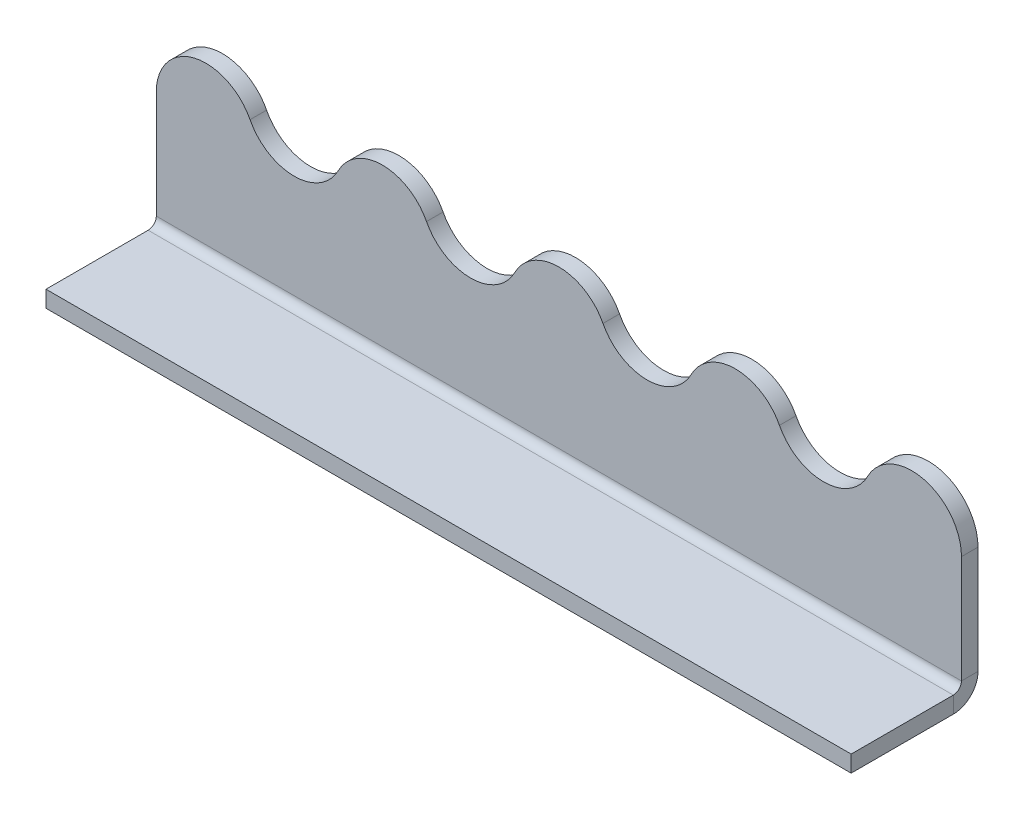
from build123d import *

# Parameters (mm, degrees)
SM_BASE_FLANGE_1_DEPTH           = 1.5
SM_EDGE_FLANGE_1_STRIP_W         = 7.48
SM_EDGE_FLANGE_1_STRIP_H         = 1.5
SM_EDGE_FLANGE_1_STRIP_CUT_DEPTH = 73
SM_EDGE_FLANGE_1_DEPTH           = 73


# Sheet-metal steps are written as plain solids
with BuildPart() as part:
    # Sketch 1 → Базовая кромка1 (new body)
    with BuildSketch(Plane.XY):
        with BuildLine():
            Line((-36.5, 0), (36.5, 0))
            Line((36.5, 0), (36.5, 10.5))
            ThreePointArc((36.5, 10.5), (33.060660172, 14.873213921), (28, 12.561552813))
            ThreePointArc((28, 12.561552813), (24, 10.123105626), (20, 12.561552813))
            ThreePointArc((20, 12.561552813), (16, 15), (12, 12.561552813))
            ThreePointArc((12, 12.561552813), (8, 10.123105626), (4, 12.561552813))
            ThreePointArc((4, 12.561552813), (0, 15), (-4, 12.561552813))
            ThreePointArc((-4, 12.561552813), (-8, 10.123105626), (-12, 12.561552813))
            ThreePointArc((-12, 12.561552813), (-16, 15), (-20, 12.561552813))
            ThreePointArc((-20, 12.561552813), (-24, 10.123105626), (-28, 12.561552813))
            ThreePointArc((-28, 12.561552813), (-33.060660172, 14.873213921), (-36.5, 10.5))
            Line((-36.5, 10.5), (-36.5, 0))
        make_face()
    extrude(amount=-SM_BASE_FLANGE_1_DEPTH)

    # Ребро-кромка1 strip (across the edge) → Ребро-кромка1 strip cut (cut)
    with BuildSketch(Plane.YZ.offset(-36.5)):
        with Locations((-3, -0.75)):
            Rectangle(SM_EDGE_FLANGE_1_STRIP_W, SM_EDGE_FLANGE_1_STRIP_H)
    extrude(amount=SM_EDGE_FLANGE_1_STRIP_CUT_DEPTH, mode=Mode.SUBTRACT)

    # Ребро-кромка1 section (across the edge) → Ребро-кромка1 (add)
    with BuildSketch(Plane.YZ.offset(-36.5)):
        with BuildLine():
            Line((-1.5, 0.74), (-1.5, 10))
            Line((-1.5, 10), (0, 10))
            Line((0, 10), (0, 0.74))
            ThreePointArc((0, 0.74), (0.216740982, 0.216740982), (0.74, 0))
            Line((0.74, 0), (0.74, -1.5))
            ThreePointArc((0.74, -1.5), (-0.84391919, -0.84391919), (-1.5, 0.74))
        make_face()
    extrude(amount=SM_EDGE_FLANGE_1_DEPTH)


solid = part.part
